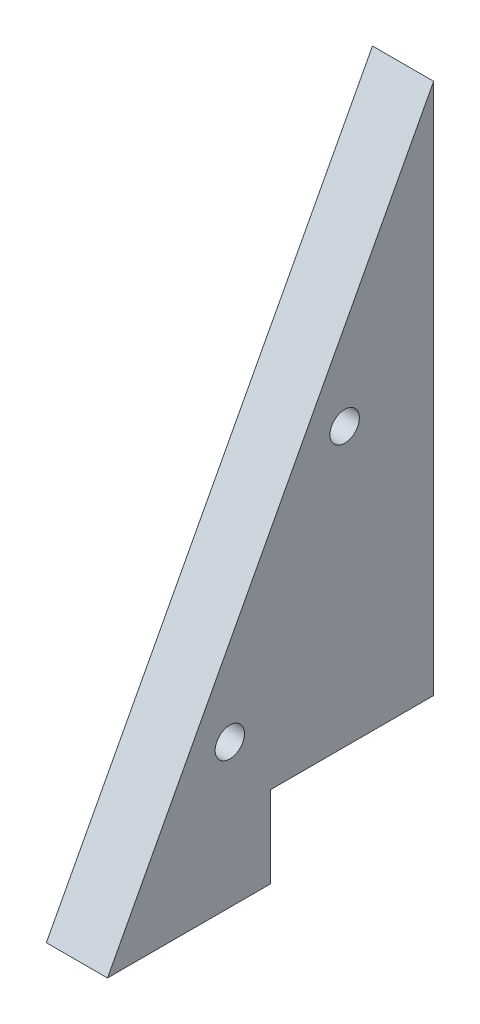
from build123d import *

# Parameters (mm, degrees)
BOSS_EXTRUDE1_DEPTH = 9.525
SKETCH2_R           = 1.905
CUT_EXTRUDE1_DEPTH  = 9.525
SKETCH3_R           = 2.286
CUT_EXTRUDE2_DEPTH  = 100.317420658


with BuildPart() as part:
    # Sketch1 → Boss-Extrude1 (new body)
    with BuildSketch(Plane(origin=(0, 0, 0), x_dir=(0, 0, -1), z_dir=(1, 0, 0))):
        Polygon((0, 0), (-25.4, 0), (25.4, 95.54090444), (25.4, 12.7), (0, 12.7), align=None)
    extrude(amount=BOSS_EXTRUDE1_DEPTH)

    # Sketch2 → Cut-Extrude1 (cut)
    with BuildSketch(Plane.XZ.offset(-12.7)):
        with Locations((4.7625, -19.05)):
            Circle(SKETCH2_R)
        with Locations((4.7625, -6.35)):
            Circle(SKETCH2_R)
    extrude(amount=-CUT_EXTRUDE1_DEPTH, mode=Mode.SUBTRACT)

    # Sketch3 → Cut-Extrude2 (cut, through all)
    with BuildSketch(Plane(origin=(9.525, 0, 0), x_dir=(0, 0, -1), z_dir=(1, 0, 0))):
        with Locations((-6.35, 22.301993292)):
            Circle(SKETCH3_R)
        with Locations((11.536866542, 55.94229658)):
            Circle(SKETCH3_R)
    extrude(amount=-CUT_EXTRUDE2_DEPTH, mode=Mode.SUBTRACT)


solid = part.part
